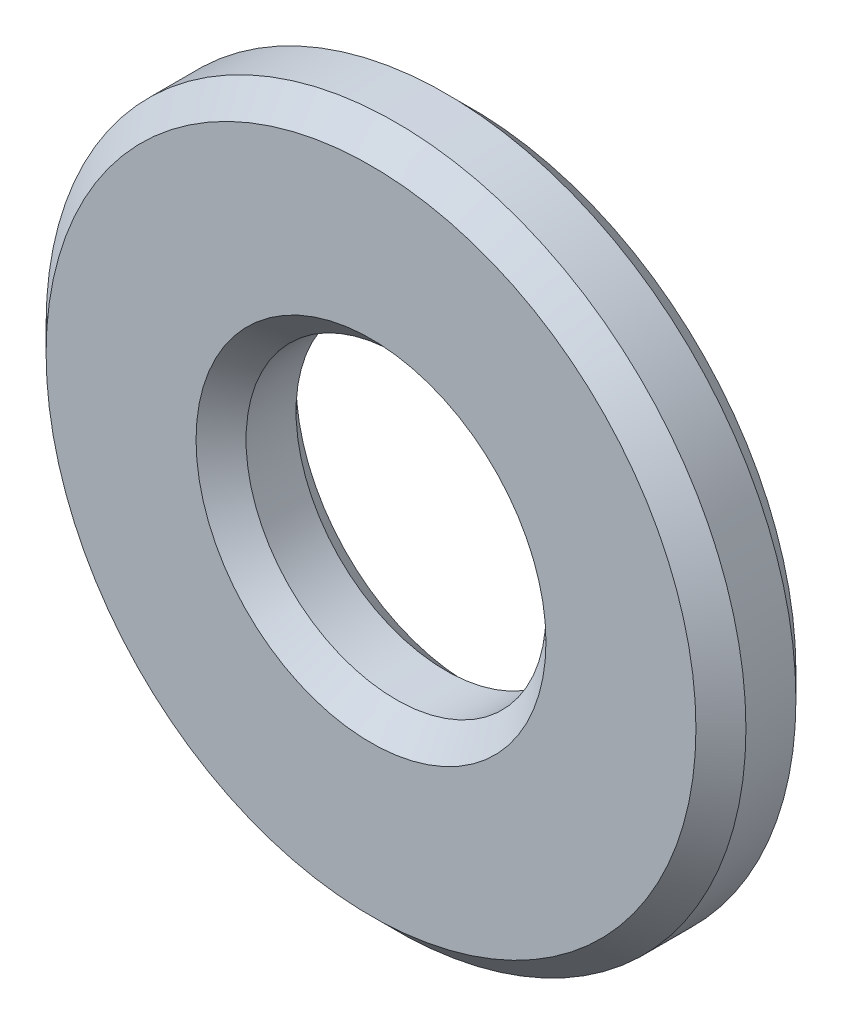
from build123d import *

# Parameters (mm, degrees)
SKETCH2_R          = 3.5
SKETCH2_R_2        = 1.5
BASE_FLANGE1_DEPTH = 1
CHAMFER1_SIZE      = 0.25


# Sheet-metal steps are written as plain solids
with BuildPart() as part:
    # Sketch2 → Base-Flange1 (new body)
    with BuildSketch(Plane.XY):
        Circle(SKETCH2_R)
        Circle(SKETCH2_R_2, mode=Mode.SUBTRACT)
    extrude(amount=-BASE_FLANGE1_DEPTH)

    # Chamfer1
    chamfer1_edges = [part.edges().sort_by_distance(p)[0] for p in [
        (-3.5, 0, 0),
        (-3.5, 0, -1),
        (-1.5, 0, -1),
        (-1.5, 0, 0),
    ]]
    chamfer(chamfer1_edges, length=CHAMFER1_SIZE)


solid = part.part
